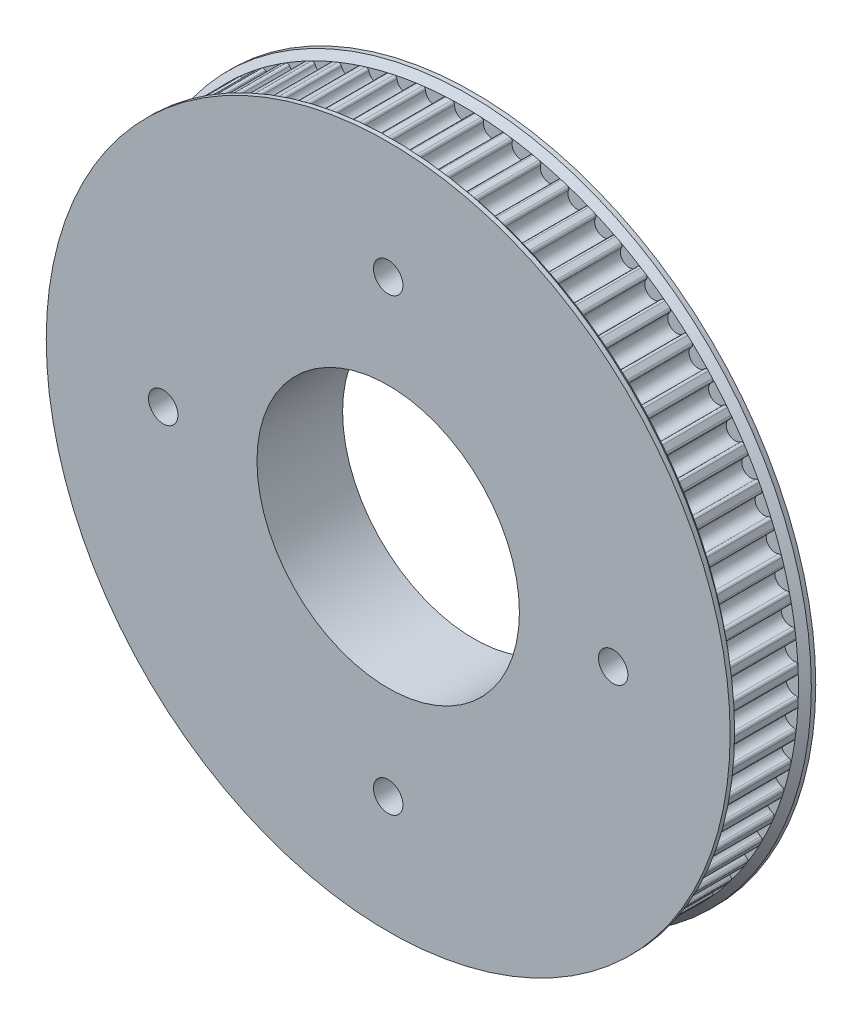
from build123d import *

# Parameters (mm, degrees)
CROQUIS2_R                 = 56.724279513
SALIENTE_EXTRUIR1_DEPTH    = 5.5
CORTAR_EXTRUIR2_DEPTH      = 81.408567781
MATRIZC4_COUNT             = 72
CORTAR_EXTRUIR3_DEPTH      = 83.225885714
CORTAR_EXTRUIR3_DEPTH_BACK = 83.225885714
CROQUIS7_R                 = 2.4892
CROQUIS7_R_2               = 22.225
CORTAR_EXTRUIR4_DEPTH      = 14.5


with BuildPart() as part:
    # Croquis2 → Saliente-Extruir1 (new, symmetric)
    with BuildSketch(Plane.XY):
        Circle(CROQUIS2_R)
    extrude(amount=SALIENTE_EXTRUIR1_DEPTH, both=True)

    # Croquis4 → Cortar-Extruir2 (cut, symmetric)
    with BuildSketch(Plane.XY):
        with BuildLine():
            ThreePointArc((-1.96863038, 56.690108314), (0, 56.724279513), (1.96863038, 56.690108314))
            ThreePointArc((1.96863038, 56.690108314), (1.64939927, 56.56417112), (1.523991489, 56.244731662))
            ThreePointArc((1.523991489, 56.244731662), (0, 54.664279513), (-1.523991489, 56.244731662))
            ThreePointArc((-1.523991489, 56.244731662), (-1.64939927, 56.56417112), (-1.96863038, 56.690108314))
        make_face()
    cortar_extruir2 = extrude(amount=CORTAR_EXTRUIR2_DEPTH, both=True, mode=Mode.SUBTRACT)

    # MatrizC4: Cortar-Extruir2 ×72 about axis
    matrizc4_axis = Axis((0, 0, 0), (0, 0, 1))
    for i in range(1, MATRIZC4_COUNT):
        add(cortar_extruir2.rotate(matrizc4_axis, i * 360 / MATRIZC4_COUNT), mode=Mode.SUBTRACT)

    # Croquis5 → Revolución1 (revolve)
    with BuildSketch(Plane(origin=(0, 0, 0), x_dir=(1, 0, 0), z_dir=(0, 1, 0))):
        Polygon((0, 5.5), (56.724279513, 5.5), (57.916033106, 6.5), (57.916033106, 7.25), (0, 7.25), align=None)
        Polygon((0, -7.25), (0, -5.5), (56.724279513, -5.5), (57.916033106, -6.5), (57.916033106, -7.25), align=None)
    revolve(axis=Axis((0, 0, 0), (0, 0, -1)))

    # Croquis6 → Cortar-Extruir3 (cut, two sides: drawn at the far end of the back side and taken through both)
    with BuildSketch(Plane.XY.offset(-CORTAR_EXTRUIR3_DEPTH_BACK)):
        Polygon((2.995350932, -6.3881), (3.688171255, -6.3881), (4.034581416, -5.7881), (7.029932348, -0.6), (7.376342509, 0), (7.029932348, 0.6), (4.034581416, 5.7881), (3.688171255, 6.3881), (2.995350932, 6.3881), (-2.995350932, 6.3881), (-3.688171255, 6.3881), (-4.034581416, 5.7881), (-7.029932348, 0.6), (-7.376342509, 0), (-7.029932348, -0.6), (-4.034581416, -5.7881), (-3.688171255, -6.3881), (-2.995350932, -6.3881), align=None)
        with BuildLine():
            Line((3.688171255, 6.3881), (4.034581416, 5.7881))
            ThreePointArc((4.034581416, 5.7881), (3.980991578, 5.9881), (4.034581416, 6.1881))
            ThreePointArc((4.034581416, 6.1881), (3.888171255, 6.734510162), (3.341761093, 6.5881))
            ThreePointArc((3.341761093, 6.5881), (3.195350932, 6.441689838), (2.995350932, 6.3881))
            Line((2.995350932, 6.3881), (3.688171255, 6.3881))
        make_face()
        with BuildLine():
            Line((-3.688171255, 6.3881), (-2.995350932, 6.3881))
            ThreePointArc((-2.995350932, 6.3881), (-3.195350932, 6.441689838), (-3.341761093, 6.5881))
            ThreePointArc((-3.341761093, 6.5881), (-3.888171255, 6.734510162), (-4.034581416, 6.1881))
            ThreePointArc((-4.034581416, 6.1881), (-3.980991578, 5.9881), (-4.034581416, 5.7881))
            Line((-4.034581416, 5.7881), (-3.688171255, 6.3881))
        make_face()
        with BuildLine():
            ThreePointArc((-7.376342509, -0.4), (-7.176342509, -0.453589838), (-7.029932348, -0.6))
            Line((-7.029932348, -0.6), (-7.376342509, 0))
            Line((-7.376342509, 0), (-7.029932348, 0.6))
            ThreePointArc((-7.029932348, 0.6), (-7.176342509, 0.453589838), (-7.376342509, 0.4))
            ThreePointArc((-7.376342509, 0.4), (-7.776342509, 0), (-7.376342509, -0.4))
        make_face()
        with BuildLine():
            ThreePointArc((-3.341761093, -6.5881), (-3.195350932, -6.441689838), (-2.995350932, -6.3881))
            Line((-2.995350932, -6.3881), (-3.688171255, -6.3881))
            Line((-3.688171255, -6.3881), (-4.034581416, -5.7881))
            ThreePointArc((-4.034581416, -5.7881), (-3.980991578, -5.9881), (-4.034581416, -6.1881))
            ThreePointArc((-4.034581416, -6.1881), (-3.888171255, -6.734510162), (-3.341761093, -6.5881))
        make_face()
        with BuildLine():
            Line((4.034581416, -5.7881), (3.688171255, -6.3881))
            Line((3.688171255, -6.3881), (2.995350932, -6.3881))
            ThreePointArc((2.995350932, -6.3881), (3.195350932, -6.441689838), (3.341761093, -6.5881))
            ThreePointArc((3.341761093, -6.5881), (3.888171255, -6.734510162), (4.034581416, -6.1881))
            ThreePointArc((4.034581416, -6.1881), (3.980991578, -5.9881), (4.034581416, -5.7881))
        make_face()
        with BuildLine():
            Line((7.376342509, 0), (7.029932348, -0.6))
            ThreePointArc((7.029932348, -0.6), (7.176342509, -0.453589838), (7.376342509, -0.4))
            ThreePointArc((7.376342509, -0.4), (7.776342509, 0), (7.376342509, 0.4))
            ThreePointArc((7.376342509, 0.4), (7.176342509, 0.453589838), (7.029932348, 0.6))
            Line((7.029932348, 0.6), (7.376342509, 0))
        make_face()
    extrude(amount=CORTAR_EXTRUIR3_DEPTH + CORTAR_EXTRUIR3_DEPTH_BACK, mode=Mode.SUBTRACT)

    # Croquis7 → Cortar-Extruir4 (cut)
    with BuildSketch(Plane.XY.offset(7.25)):
        with Locations((0, 38.1)):
            Circle(CROQUIS7_R)
        Circle(CROQUIS7_R_2)
        with Locations((38.1, 0)):
            Circle(CROQUIS7_R)
        with Locations((0, -38.1)):
            Circle(CROQUIS7_R)
        with Locations((-38.1, 0)):
            Circle(CROQUIS7_R)
    extrude(amount=-CORTAR_EXTRUIR4_DEPTH, mode=Mode.SUBTRACT)


solid = part.part
